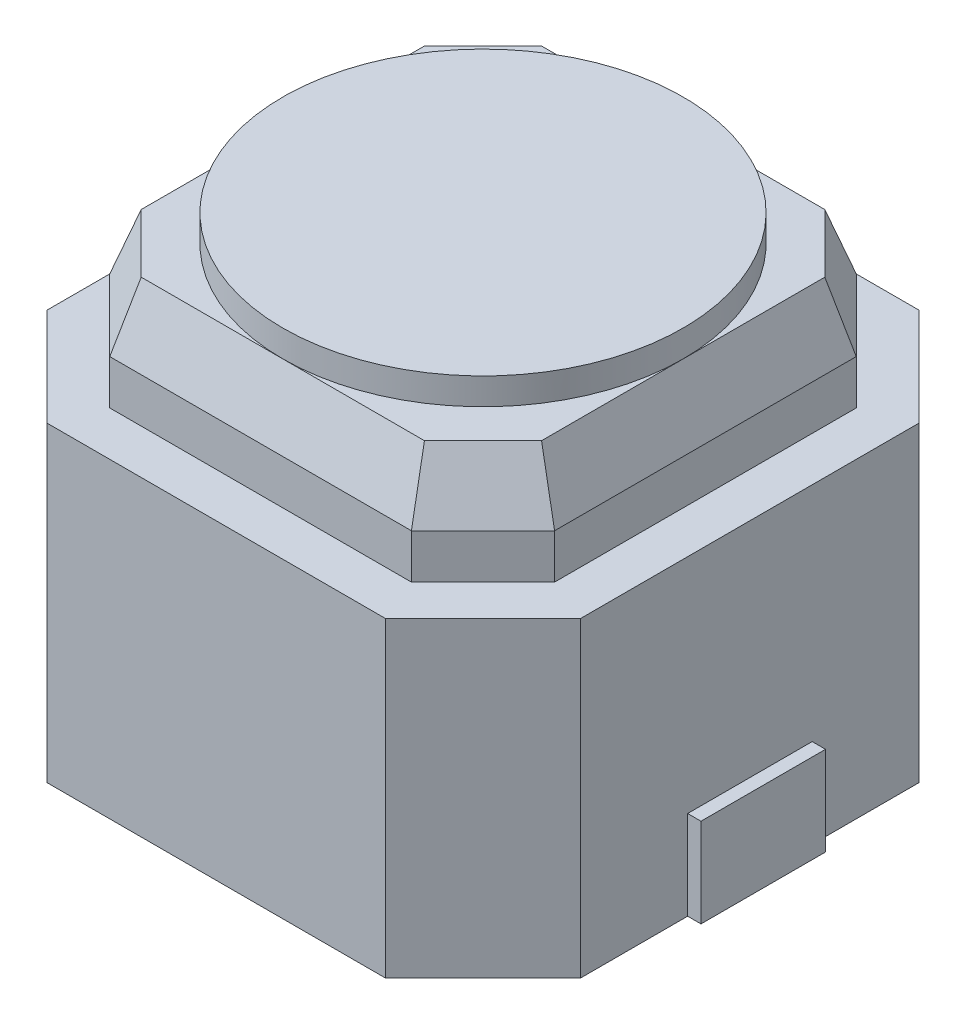
from build123d import *

# Parameters (mm, degrees)
EXTRUDE_1_DEPTH = 3.5
EXTRUDE_2_DEPTH = 0.5
EXTRUDE_3_DEPTH = 0.7
SKETCH_4_R      = 2.25
EXTRUDE_4_DEPTH = 0.3
EXTRUDE_5_DEPTH = 1


with BuildPart() as part:
    # 草图1 → 凸台-拉伸1 (new body)
    with BuildSketch(Plane(origin=(0, 0, 0), x_dir=(1, 0, 0), z_dir=(0, 1, 0))):
        Polygon((0, 4.902463921), (0, 1.097536079), (0.55, 0.547536079), (1.097536079, 0), (4.902463921, 0), (5.45, 0.547536079), (6, 1.097536079), (6, 4.902463921), (5.45, 5.452463921), (4.902463921, 6), (1.097536079, 6), (0.55, 5.452463921), align=None)
    extrude(amount=EXTRUDE_1_DEPTH)

    # 草图2 → 凸台-拉伸2 (add)
    with BuildSketch(Plane(origin=(0, 3.5, 0), x_dir=(1, 0, 0), z_dir=(0, 1, 0))):
        Polygon((1.30464286, 5.5), (4.69535714, 5.5), (5.5, 4.69535714), (5.5, 1.30464286), (4.69535714, 0.5), (1.30464286, 0.5), (0.5, 1.30464286), (0.5, 4.69535714), align=None)
    extrude(amount=EXTRUDE_2_DEPTH)

    # 草图3 → 凸台-拉伸3 (add)
    with BuildSketch(Plane(origin=(0, 4, 0), x_dir=(1, 0, 0), z_dir=(0, 1, 0))):
        Polygon((4.591803749, 5.25), (1.408196251, 5.25), (0.75, 4.591803749), (0.75, 1.408196251), (1.408196251, 0.75), (4.591803749, 0.75), (5.25, 1.408196251), (5.25, 4.591803749), align=None)
    extrude(amount=EXTRUDE_3_DEPTH)

    # 草图4 → 凸台-拉伸4 (add)
    with BuildSketch(Plane(origin=(0, 4.7, 0), x_dir=(1, 0, 0), z_dir=(0, 1, 0))):
        with Locations(Location((3, 3, 0), (0, 0, 270))):
            Circle(SKETCH_4_R)
    extrude(amount=EXTRUDE_4_DEPTH)

    # 放样2: read off the stored shape, not the designer's step
    # 放样2: loft between two sections, ruled curve by curve
    loft_2_from = [
        Edge.make_line((1.408196251, 4.7, -5.25), (0.75, 4.7, -4.591803749)),
        Edge.make_line((5.25, 4.7, -4.591803749), (4.591803749, 4.7, -5.25)),
        Edge.make_line((4.591803749, 4.7, -0.75), (5.25, 4.7, -1.408196251)),
        Edge.make_line((0.75, 4.7, -1.408196251), (1.408196251, 4.7, -0.75)),
        Edge.make_line((4.591803749, 4.7, -5.25), (1.408196251, 4.7, -5.25)),
        Edge.make_line((5.25, 4.7, -1.408196251), (5.25, 4.7, -4.591803749)),
        Edge.make_line((0.75, 4.7, -1.408196251), (0.75, 4.7, -4.591803749)),
        Edge.make_line((1.408196251, 4.7, -0.75), (4.591803749, 4.7, -0.75)),
    ]
    loft_2_to = [
        Edge.make_line((1.30464286, 4, -5.5), (0.5, 4, -4.69535714)),
        Edge.make_line((5.5, 4, -4.69535714), (4.69535714, 4, -5.5)),
        Edge.make_line((4.69535714, 4, -0.5), (5.5, 4, -1.30464286)),
        Edge.make_line((0.5, 4, -1.30464286), (1.30464286, 4, -0.5)),
        Edge.make_line((4.69535714, 4, -5.5), (1.30464286, 4, -5.5)),
        Edge.make_line((5.5, 4, -1.30464286), (5.5, 4, -4.69535714)),
        Edge.make_line((0.5, 4, -1.30464286), (0.5, 4, -4.69535714)),
        Edge.make_line((1.30464286, 4, -0.5), (4.69535714, 4, -0.5)),
    ]
    loft_2 = Solid(Shell([*[Face.make_surface_from_curves(loft_2_from[k], loft_2_to[k]) for k in range(8)], Face(Wire(loft_2_from)), Face(Wire(loft_2_to))]))
    add(loft_2)

    # 草图5 → 凸台-拉伸5 (add)
    with BuildSketch(Plane.XZ):
        Polygon((0, -3), (0, -2.3), (-0.15, -2.3), (-0.15, -3.7), (0, -3.7), align=None)
        Polygon((6, -3), (6, -2.3), (6.15, -2.3), (6.15, -3.7), (6, -3.7), align=None)
    extrude(amount=-EXTRUDE_5_DEPTH)


solid = part.part
